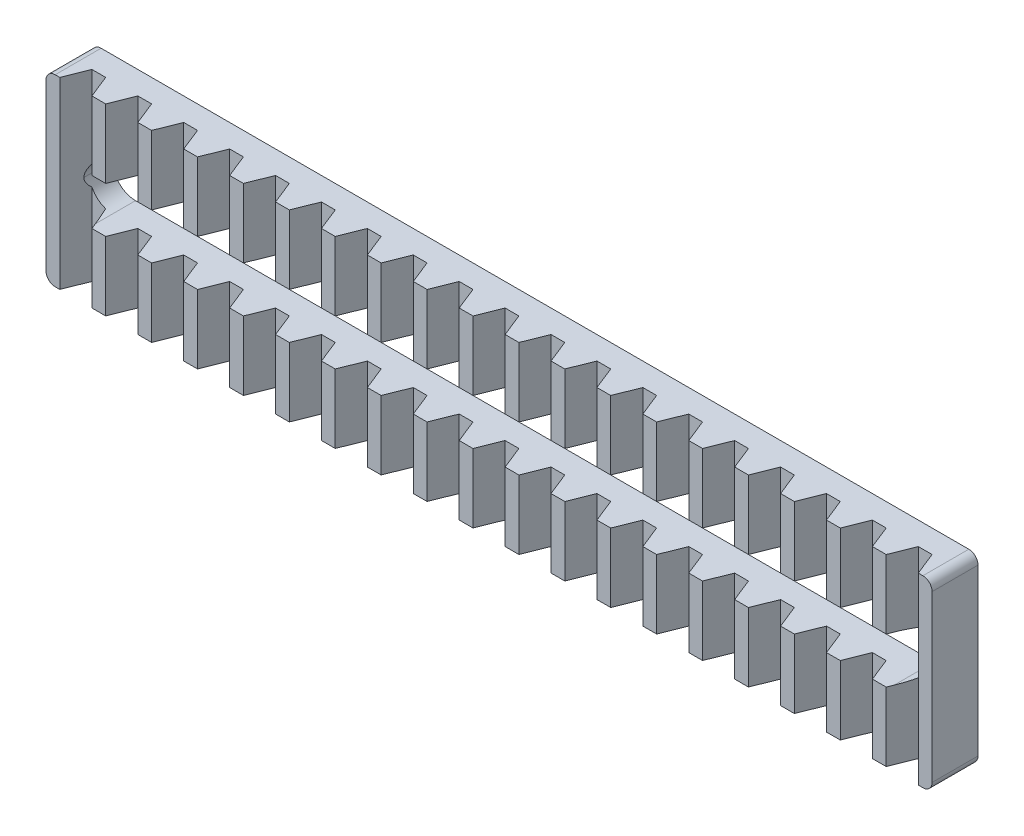
from build123d import *

# Parameters (mm, degrees)
SKETCH1_W           = 193
SKETCH1_H           = 10
BOSS_EXTRUDE1_DEPTH = 40
CUT_EXTRUDE1_DEPTH  = 44
SKETCH3_W           = 184
SKETCH3_H           = 10
CUT_EXTRUDE2_DEPTH  = 22
FILLET1_R           = 5
SKETCH4_W           = 184
SKETCH4_H           = 5
CUT_EXTRUDE3_DEPTH  = 4
FILLET3_R           = 2
SKETCH4_4_W         = 184
SKETCH4_4_H         = 1.5
CUT_EXTRUDE4_DEPTH  = 2
FILLET4_R           = 2.5
FILLET5_R           = 4


with BuildPart() as part:
    # Sketch1 → Boss-Extrude1 (new body)
    with BuildSketch(Plane(origin=(0, 0, 0), x_dir=(1, 0, 0), z_dir=(0, 1, 0))):
        Rectangle(SKETCH1_W, SKETCH1_H)
    extrude(amount=BOSS_EXTRUDE1_DEPTH)

    # Sketch2 → Cut-Extrude1 (cut)
    with BuildSketch(Plane(origin=(0, 0, 0), x_dir=(1, 0, 0), z_dir=(0, 1, 0))):
        Polygon((-96.5, -5), (-93.5, -5), (-91.5, 0), (-88.5, 0), (-86.5, -5), (-83.5, -5), (-81.5, 0), (-78.5, 0), (-76.5, -5), (-73.5, -5), (-71.5, 0), (-68.5, 0), (-66.5, -5), (-63.5, -5), (-61.5, 0), (-58.5, 0), (-56.5, -5), (-53.5, -5), (-51.5, 0), (-48.5, 0), (-46.5, -5), (-43.5, -5), (-41.5, 0), (-38.5, 0), (-36.5, -5), (-33.5, -5), (-31.5, 0), (-28.5, 0), (-26.5, -5), (-23.5, -5), (-21.5, 0), (-18.5, 0), (-16.5, -5), (-13.5, -5), (-11.5, 0), (-8.5, 0), (-6.5, -5), (-3.5, -5), (-1.5, 0), (1.5, 0), (3.5, -5), (6.5, -5), (8.5, 0), (11.5, 0), (13.5, -5), (16.5, -5), (18.5, 0), (21.5, 0), (23.5, -5), (26.5, -5), (28.5, 0), (31.5, 0), (33.5, -5), (36.5, -5), (38.5, 0), (41.5, 0), (43.5, -5), (46.5, -5), (48.5, 0), (51.5, 0), (53.5, -5), (56.5, -5), (58.5, 0), (61.5, 0), (63.5, -5), (66.5, -5), (68.5, 0), (71.5, 0), (73.5, -5), (76.5, -5), (78.5, 0), (81.5, 0), (83.5, -5), (86.5, -5), (88.5, 0), (91.5, 0), (93.5, -5), (96.5, -5), (96.5, -20.768022812), (-96.5, -20.768022812), align=None)
    extrude(amount=CUT_EXTRUDE1_DEPTH, mode=Mode.SUBTRACT)

    # Sketch3 → Cut-Extrude2 (cut, symmetric)
    with BuildSketch(Plane.XY):
        with Locations((0, 20)):
            Rectangle(SKETCH3_W, SKETCH3_H)
    extrude(amount=CUT_EXTRUDE2_DEPTH, both=True, mode=Mode.SUBTRACT)

    # Fillet1
    fillet1_edges = [part.edges().sort_by_distance(p)[0] for p in [
        (92, 15, -1.875),
        (92, 25, -1.875),
        (-92, 15, -1.875),
        (-92, 25, -1.875),
    ]]
    fillet(fillet1_edges, radius=FILLET1_R - 0.0001)  # a hair under: the kernel refuses the full size

    # Sketch4 → Cut-Extrude3 (cut)
    with BuildSketch(Plane.XY.offset(-5)):
        with Locations((0, 32.5)):
            Rectangle(SKETCH4_W, SKETCH4_H)
        with Locations((0, 7.5)):
            Rectangle(SKETCH4_W, SKETCH4_H)
    extrude(amount=CUT_EXTRUDE3_DEPTH, mode=Mode.SUBTRACT)

    # Fillet3
    fillet3_edges = [part.edges().sort_by_distance(p)[0] for p in [
        (96.5, 40, 0),
        (-96.5, 40, 0),
        (96.5, 0, 0),
        (-96.5, 0, 0),
    ]]
    fillet(fillet3_edges, radius=FILLET3_R)

    # Sketch4<4> → Cut-Extrude4 (cut)
    with BuildSketch(Plane.XY.offset(-5)):
        with Locations((0, 35.75)):
            Rectangle(SKETCH4_4_W, SKETCH4_4_H)
        with Locations((0, 29.25)):
            Rectangle(SKETCH4_4_W, SKETCH4_4_H)
        with Locations((0, 10.75)):
            Rectangle(SKETCH4_4_W, SKETCH4_4_H)
        with Locations((0, 4.25)):
            Rectangle(SKETCH4_4_W, SKETCH4_4_H)
    extrude(amount=CUT_EXTRUDE4_DEPTH, mode=Mode.SUBTRACT)

    # Fillet4
    fillet4_edges = [part.edges().sort_by_distance(p)[0] for p in [
        (92, 35, -2),
        (92, 30, -2),
        (-92, 35, -2),
        (-92, 30, -2),
        (-92, 10, -2),
        (-92, 5, -2),
        (92, 10, -2),
        (92, 5, -2),
    ]]
    fillet(fillet4_edges, radius=FILLET4_R - 0.0001)  # a hair under: the kernel refuses the full size

    # Fillet5
    fillet5_edges = [part.edges().sort_by_distance(p)[0] for p in [
        (-92, 3.5, -4),
        (-92, 11.5, -4),
        (-92, 28.5, -4),
        (-92, 36.5, -4),
        (92, 11.5, -4),
        (92, 3.5, -4),
        (92, 28.5, -4),
        (92, 36.5, -4),
    ]]
    fillet(fillet5_edges, radius=FILLET5_R - 0.0001)  # a hair under: the kernel refuses the full size


solid = part.part
